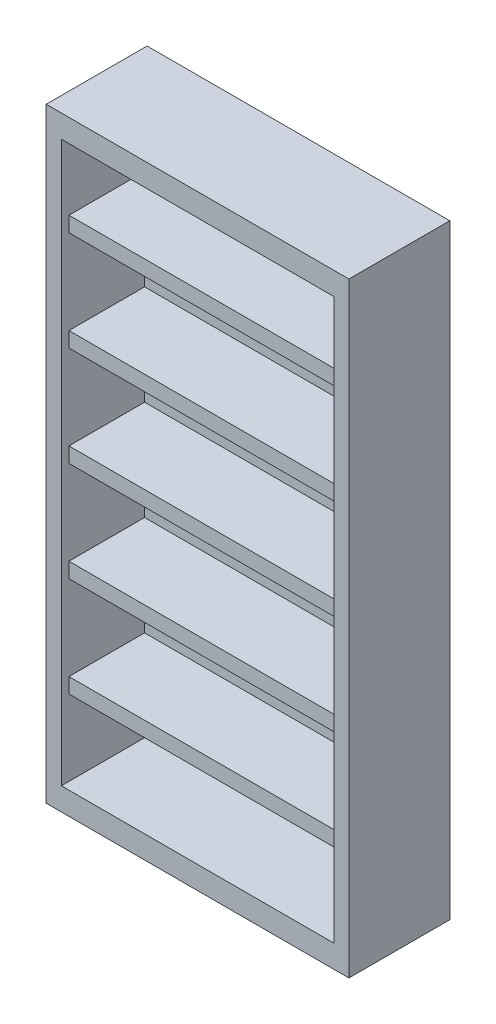
from build123d import *

# Parameters (mm, degrees)
SKETCH1_W           = 100
SKETCH1_H           = 33.333333334
BOSS_EXTRUDE1_DEPTH = 100
SKETCH2_W           = 90
SKETCH2_H           = 185
CUT_EXTRUDE1_DEPTH  = 27.5
SKETCH3_W           = 90
SKETCH3_H           = 5
BOSS_EXTRUDE2_DEPTH = 25


with BuildPart() as part:
    # Sketch1 → Boss-Extrude1 (new, symmetric)
    with BuildSketch(Plane(origin=(0, 0, 0), x_dir=(1, 0, 0), z_dir=(0, 1, 0))):
        Rectangle(SKETCH1_W, SKETCH1_H)
    extrude(amount=BOSS_EXTRUDE1_DEPTH, both=True)

    # Sketch2 → Cut-Extrude1 (cut)
    with BuildSketch(Plane.XY.offset(16.666666667)):
        Rectangle(SKETCH2_W, SKETCH2_H)
    extrude(amount=-CUT_EXTRUDE1_DEPTH, mode=Mode.SUBTRACT)

    # Sketch3 → Boss-Extrude2 (add)
    with BuildSketch(Plane.XY.offset(-10.833333333)):
        with Locations((0, -65)):
            Rectangle(SKETCH3_W, SKETCH3_H)
        with Locations((0, -32)):
            Rectangle(SKETCH3_W, SKETCH3_H)
        with Locations((0, 1)):
            Rectangle(SKETCH3_W, SKETCH3_H)
        with Locations((0, 34)):
            Rectangle(SKETCH3_W, SKETCH3_H)
        with Locations((0, 67)):
            Rectangle(SKETCH3_W, SKETCH3_H)
    extrude(amount=BOSS_EXTRUDE2_DEPTH)


solid = part.part
